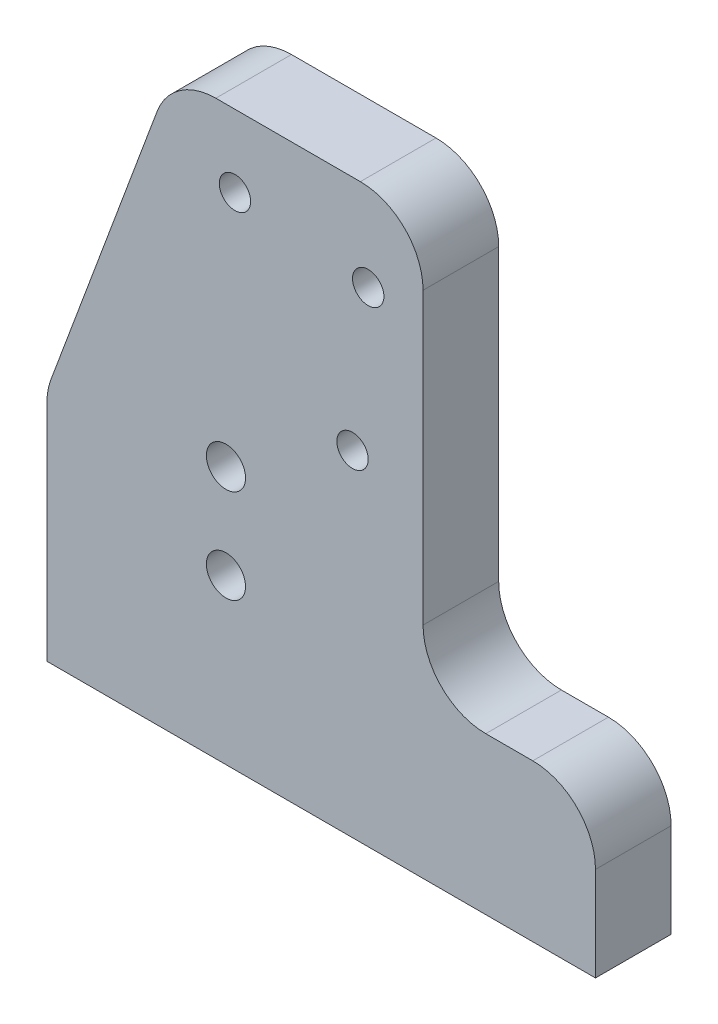
from build123d import *

# Parameters (mm, degrees)
BOSS_EXTRUDE1_DEPTH       = 4.826
M3X0_5_TAPPED_HOLE2_D     = 2
M3X0_5_TAPPED_HOLE3_D     = 2.5
M3X0_5_TAPPED_HOLE3_DEPTH = 5
M3X0_5_TAPPED_HOLE3_TIP   = 0.751075774
FILLET2_R                 = 4
CUT_EXTRUDE1_DEPTH        = 10
SKETCH23_R                = 1
CUT_EXTRUDE2_DEPTH        = 50.732185514
SKETCH27_W                = 35
SKETCH27_H                = 4.826
SKETCH27_R                = 1.25
BOSS_EXTRUDE2_DEPTH       = 1.5
SKETCH28_R                = 1.25
CUT_EXTRUDE3_DEPTH        = 50.732185514


with BuildPart() as part:
    # Sketch1 → Boss-Extrude1 (new body)
    with BuildSketch(Plane.XY):
        Polygon((0, 13.5), (0, 0), (35, 0), (35, 8.5), (24, 8.5), (24, 35), (8, 35), align=None)
    extrude(amount=BOSS_EXTRUDE1_DEPTH)

    # M3x0.5 Tapped Hole2 (through all)
    with Locations(Plane.XY.offset(4.826)):
        with Locations((12, 30.4)):
            Hole(M3X0_5_TAPPED_HOLE2_D / 2)

    # M3x0.5 Tapped Hole3
    with Locations(Plane(origin=(0, 0, 0), x_dir=(-1, 0, 0), z_dir=(0, -1, 0))):
        with Locations((-16.73, -2.413), (-28.73, -2.413)):
            Hole(M3X0_5_TAPPED_HOLE3_D / 2, depth=M3X0_5_TAPPED_HOLE3_DEPTH)
            with Locations((0, 0, -(M3X0_5_TAPPED_HOLE3_DEPTH + M3X0_5_TAPPED_HOLE3_TIP / 2))):  # 118° drill point
                Cone(0, M3X0_5_TAPPED_HOLE3_D / 2, M3X0_5_TAPPED_HOLE3_TIP, mode=Mode.SUBTRACT)

    # Fillet2
    fillet2_edges = [part.edges().sort_by_distance(p)[0] for p in [
        (35, 8.5, 2.413),
        (24, 8.5, 2.413),
        (24, 35, 2.413),
        (0, 13.5, 2.413),
        (8, 35, 2.413),
    ]]
    fillet(fillet2_edges, radius=FILLET2_R)

    # Sketch19 → Cut-Extrude1 (cut)
    with BuildSketch(Plane.XY.offset(4.826)):
        with BuildLine():
            ThreePointArc((18.5, 19.9), (19.5, 18.9), (20.5, 19.9))
            ThreePointArc((20.5, 19.9), (19.5, 20.9), (18.5, 19.9))
        make_face()
    extrude(amount=-CUT_EXTRUDE1_DEPTH, mode=Mode.SUBTRACT)

    # Sketch23 → Cut-Extrude2 (cut, through all)
    with BuildSketch(Plane.XY.offset(4.826)):
        with Locations((20.5, 29.4)):
            Circle(SKETCH23_R)
    extrude(amount=-CUT_EXTRUDE2_DEPTH, mode=Mode.SUBTRACT)

    # Sketch27 → Boss-Extrude2 (add)
    with BuildSketch(Plane.XZ):
        with Locations((17.5, 2.413)):
            Rectangle(SKETCH27_W, SKETCH27_H)
        with Locations((16.73, 2.413)):
            Circle(SKETCH27_R, mode=Mode.SUBTRACT)
        with Locations((28.73, 2.413)):
            Circle(SKETCH27_R, mode=Mode.SUBTRACT)
    extrude(amount=BOSS_EXTRUDE2_DEPTH)

    # Sketch28 → Cut-Extrude3 (cut, through all)
    with BuildSketch(Plane.XY.offset(4.826)):
        with Locations((11.425, 14.96)):
            Circle(SKETCH28_R)
        with Locations((11.425, 8.96)):
            Circle(SKETCH28_R)
    extrude(amount=-CUT_EXTRUDE3_DEPTH, mode=Mode.SUBTRACT)


solid = part.part
